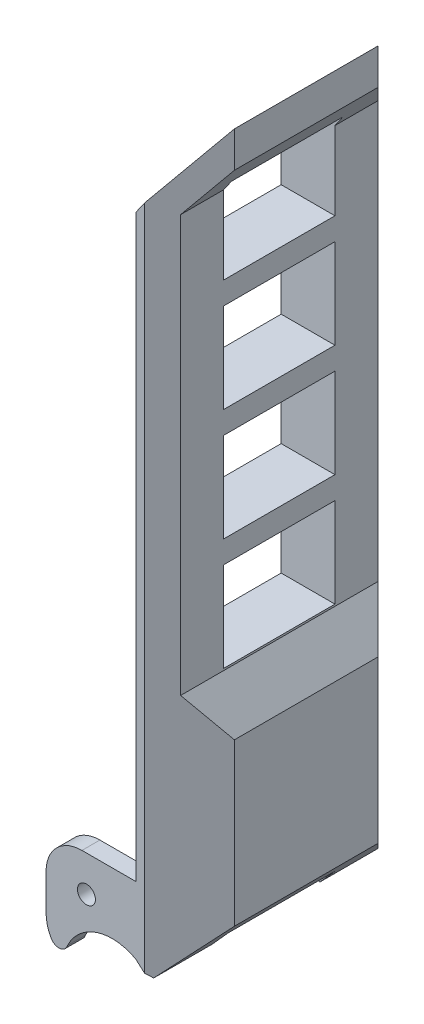
from build123d import *

# Parameters (mm, degrees)
SKETCH_1_W             = 26
SKETCH_1_H             = 82
EXTRUDE_1_DEPTH        = 9
CHAMFER_1_SIZE         = 5
CUT_EXTRUDE_1_DEPTH    = 87.492774265
SKETCH_3_OUTSIDE_W     = 45.298
SKETCH_3_OUTSIDE_H     = 101.298
SKETCH_3_OUTSIDE_W_2   = 20
SKETCH_3_OUTSIDE_H_2   = 55
CUT_EXTRUDE_2_DEPTH    = 3
SKETCH_4_W             = 12.420254628
SKETCH_4_H             = 10
CUT_EXTRUDE_3_DEPTH    = 87.492774265
PATTERN_LINEAR_1_COUNT = 4
PATTERN_LINEAR_1_PITCH = 12.5
CUT_EXTRUDE_4_DEPTH    = 87.492774265
SKETCH_6_W             = 12
SKETCH_6_H             = 2
CUT_EXTRUDE_5_DEPTH    = 87.492774265
SKETCH_7_W             = 15
SKETCH_7_H             = 18
CUT_EXTRUDE_6_DEPTH    = 4
CUT_EXTRUDE_7_DEPTH    = 87.492774265
CHAMFER_2_SIZE         = 1
CHAMFER_2_SIZE2        = 2
CHAMFER_3_SIZE2        = 1
CHAMFER_3_SIZE         = 4
CHAMFER_4_SIZE2        = 4
CHAMFER_4_SIZE         = 1
CHAMFER_5_SIZE         = 4.17
CHAMFER_5_SIZE_2       = 4
RIB_1_DEPTH            = 1.5
SKETCH_10_R            = 3.5
CUT_EXTRUDE_8_DEPTH    = 1.5
EXTRUDE_2_DEPTH        = 2
FILLET_1_R             = 4
FILLET_2_R             = 4.5
SKETCH_12_R            = 1
CUT_EXTRUDE_9_DEPTH    = 2
FILLET_1_OF_MIRROR_2_R = 4
FILLET_2_OF_MIRROR_2_R = 4.5
FILLET_3_R             = 1
SKETCH_13_R            = 1.5
CUT_EXTRUDE_11_DEPTH   = 2


# Read off the part's stored shape, not the designer's step: 筋1
# Some blends are built 0.0001 mm under size
with BuildPart() as part:
    # 草图1 → 凸台-拉伸1 (new body)
    with BuildSketch(Plane(origin=(0, 0, 0), x_dir=(0, 0, -1), z_dir=(1, 0, 0))):
        with Locations((13, -41)):
            Rectangle(SKETCH_1_W, SKETCH_1_H)
    extrude(amount=EXTRUDE_1_DEPTH)

    # 倒角1
    chamfer_1_edges = [part.edges().sort_by_distance(p)[0] for p in [
        (9, -41, -26),
        (9, -41, 0),
    ]]
    chamfer(chamfer_1_edges, length=CHAMFER_1_SIZE)

    # 草图2 → 切除-拉伸1 (cut, through all)
    with BuildSketch(Plane.XY):
        Polygon((9, 0), (0, -12.853332061), (0, 0), align=None)
        Polygon((9, -4), (6, -8.28444402), (6, -54.71555598), (9, -59), align=None)
    extrude(amount=-CUT_EXTRUDE_1_DEPTH, mode=Mode.SUBTRACT)

    # 草图3 outside → 切除-拉伸2 (cut)
    with BuildSketch(Plane.ZY):
        with Locations((-13, -41)):
            Rectangle(SKETCH_3_OUTSIDE_W, SKETCH_3_OUTSIDE_H)
        with Locations((-13, -31)):
            Rectangle(SKETCH_3_OUTSIDE_W_2, SKETCH_3_OUTSIDE_H_2, mode=Mode.SUBTRACT)
    extrude(amount=-CUT_EXTRUDE_2_DEPTH, mode=Mode.SUBTRACT)

    # 草图4 → 切除-拉伸3 (cut, through all)
    with BuildSketch(Plane.ZY):
        with Locations((-13, -12)):
            Rectangle(SKETCH_4_W, SKETCH_4_H)
    cut_extrude_3 = extrude(amount=-CUT_EXTRUDE_3_DEPTH, mode=Mode.SUBTRACT)

    # 阵列(线性)1: 切除-拉伸3 ×4
    with Locations(*[(0, -i * PATTERN_LINEAR_1_PITCH, 0) for i in range(1, PATTERN_LINEAR_1_COUNT)]):
        add(cut_extrude_3, mode=Mode.SUBTRACT)

    # 草图5 → 切除-拉伸4 (cut, through all)
    with BuildSketch(Plane.XY):
        Polygon((9, -77), (9, -82), (4.5, -82), align=None)
    extrude(amount=-CUT_EXTRUDE_4_DEPTH, mode=Mode.SUBTRACT)

    # 草图6 → 切除-拉伸5 (cut, through all)
    with BuildSketch(Plane(origin=(9, 0, 0), x_dir=(0, 0, -1), z_dir=(1, 0, 0))):
        with Locations((13, -81)):
            Rectangle(SKETCH_6_W, SKETCH_6_H)
    extrude(amount=-CUT_EXTRUDE_5_DEPTH, mode=Mode.SUBTRACT)

    # 草图7 → 切除-拉伸6 (cut)
    with BuildSketch(Plane.ZY.offset(-3)):
        with Locations((-13, -67.5)):
            Rectangle(SKETCH_7_W, SKETCH_7_H)
    extrude(amount=-CUT_EXTRUDE_6_DEPTH, mode=Mode.SUBTRACT)

    # 草图8 → 切除-拉伸7 (cut, through all)
    with BuildSketch(Plane.XY):
        Polygon((4.5, -82), (3, -80.677124344), (3, -82), align=None)
    extrude(amount=-CUT_EXTRUDE_7_DEPTH, mode=Mode.SUBTRACT)

    # 倒角2
    chamfer_2_edges = [part.edges().sort_by_distance(p)[0] for p in [
        (7, -58.5, -13),
    ]]
    chamfer_2_side = [part.faces().sort_by_distance(p)[0] for p in [
        (3.25, -58.5, -13),
    ]]
    chamfer(chamfer_2_edges, length=CHAMFER_2_SIZE, length2=CHAMFER_2_SIZE2, reference=chamfer_2_side[0])

    # 倒角3
    chamfer_3_edges = [part.edges().sort_by_distance(p)[0] for p in [
        (3, -67.5, -5.5),
    ]]
    chamfer_3_side = [part.faces().sort_by_distance(p)[0] for p in [
        (3.02, -67.5, -5.5),
    ]]
    chamfer(chamfer_3_edges, length=CHAMFER_3_SIZE - 0.0001, length2=CHAMFER_3_SIZE2 - 0.0001, reference=chamfer_3_side[0])  # a hair under: the kernel refuses the full size

    # 倒角4
    chamfer_4_edges = [part.edges().sort_by_distance(p)[0] for p in [
        (3, -67.5, -20.5),
    ]]
    chamfer_4_side = [part.faces().sort_by_distance(p)[0] for p in [
        (3, -67.5, -20.52),
    ]]
    chamfer(chamfer_4_edges, length=CHAMFER_4_SIZE - 0.0001, length2=CHAMFER_4_SIZE2 - 0.0001, reference=chamfer_4_side[0])  # a hair under: the kernel refuses the full size

    # 倒角5
    # the kernel refuses this chamfer: 4.17, 4 mm, written as the material it takes off along each edge
    with BuildSketch(Plane(origin=(3, -76.5, 6.229717564), x_dir=(-0.026903120245147794, -0.9996380455550276, 0), z_dir=(0, 0, -1))) as chamfer_5_piece_1_section:
        Polygon((CHAMFER_5_SIZE * 0.999638045555, -CHAMFER_5_SIZE * 0.0269031202451), (-CHAMFER_5_SIZE_2 * 0.0269031202451, -CHAMFER_5_SIZE_2 * 0.999638045555), (0, 0), align=None)
    chamfer_5_piece_1 = extrude(amount=38.459435128, mode=Mode.PRIVATE)
    chamfer_5_piece_1 = split(chamfer_5_piece_1, bisect_by=Plane(origin=(3.319672902, -80.226492904, -4.580012231), z_dir=(-0.24251850433325217, 0, -0.9701467801605912)), keep=Keep.TOP, mode=Mode.PRIVATE)
    chamfer_5_piece_1 = split(chamfer_5_piece_1, bisect_by=Plane(origin=(7.071862718, -80.226492904, -20.48201067), z_dir=(-0.24251850433325217, 0, 0.9701467801605912)), keep=Keep.TOP, mode=Mode.PRIVATE)
    add(chamfer_5_piece_1, mode=Mode.SUBTRACT)

    # 筋1 outline → 筋1 (add)
    with BuildSketch(Plane.XY.offset(-10.5)):
        Polygon((0, -74), (0, -80), (3.642685851, -80), (7, -76.5), (7, -73.5), align=None)
    rib_1 = extrude(amount=RIB_1_DEPTH)

    # 草图10 → 切除-拉伸8 (cut)
    with BuildSketch(Plane(origin=(0, 0, -10.5), x_dir=(-1, 0, 0), z_dir=(0, 0, -1))):
        with Locations((3, -77)):
            Circle(SKETCH_10_R)
    cut_extrude_8 = extrude(amount=-CUT_EXTRUDE_8_DEPTH, mode=Mode.SUBTRACT)

    # 镜向1: 筋1, 切除-拉伸8 across plane
    add(rib_1.mirror(Plane.XY.offset(-13)))
    add(cut_extrude_8.mirror(Plane.XY.offset(-13)), mode=Mode.SUBTRACT)

    # 草图11 → 凸台-拉伸2 (add)
    with BuildSketch(Plane(origin=(0, 0, -26), x_dir=(-1, 0, 0), z_dir=(0, 0, -1))):
        with BuildLine():
            Line((-3, -80.677124344), (-3, -73.177124344))
            Line((-3, -73.177124344), (7, -73.177124344))
            Line((7, -73.177124344), (7, -85.177124344))
            Line((7, -85.177124344), (4.616572218, -85.177124344))
            Line((4.616572218, -85.177124344), (4.616572218, -83.177124344))
            ThreePointArc((4.616572218, -83.177124344), (1.349260187, -80.278977091), (-3, -80.677124344))
        make_face()
    extrude_2 = extrude(amount=-EXTRUDE_2_DEPTH)

    # 圆角1
    fillet_1_edges = [part.edges().sort_by_distance(p)[0] for p in [
        (-7, -73.177124344, -25),
    ]]
    fillet(fillet_1_edges, radius=FILLET_1_R)

    # 圆角2
    # the kernel refuses this fillet: 4.5 mm, written as the material it takes off along each edge
    with BuildSketch(Plane(origin=(-7, -85.177124344, -35.927903243), x_dir=(0, 1, 0), z_dir=(0, 0, 1))) as fillet_2_piece_1:
        with BuildLine():
            CenterArc((3.971161297, -4.5), FILLET_2_R, 90, 61.943021953)
            Line((0, -2.383427782), (-0.079423226, -2.341096338))
            ThreePointArc((-0.079423226, -2.341096338), (-0.09, -1.191713891), (-0.09, 0))
            Line((-0.09, 0), (0, 0.09))
            Line((0, 0.09), (3.971161297, 0.09))
            Line((3.971161297, 0.09), (3.971161297, 0))
        make_face()
    extrude(amount=21.855806485, mode=Mode.SUBTRACT)

    # 草图12 → 切除-拉伸9 (cut)
    with BuildSketch(Plane(origin=(0, 0, -26), x_dir=(-1, 0, 0), z_dir=(0, 0, -1))):
        with Locations(Location((2.5, -77.177124344, 0), (0, 0, 90))):
            Circle(SKETCH_12_R)
    cut_extrude_9 = extrude(amount=-CUT_EXTRUDE_9_DEPTH, mode=Mode.SUBTRACT)

    # 镜向2: 凸台-拉伸2, 切除-拉伸9 across plane
    add(extrude_2.mirror(Plane.XY.offset(-13)))
    add(cut_extrude_9.mirror(Plane.XY.offset(-13)), mode=Mode.SUBTRACT)

    # 圆角1 of 镜向2
    fillet_1_of_mirror_2_edges = [part.edges().sort_by_distance(p)[0] for p in [
        (-7, -73.177124344, -1),
    ]]
    fillet(fillet_1_of_mirror_2_edges, radius=FILLET_1_OF_MIRROR_2_R)

    # 圆角2 of 镜向2
    # the kernel refuses this fillet: 4.5 mm, written as the material it takes off along each edge
    with BuildSketch(Plane(origin=(-7, -85.177124344, 9.927903243), x_dir=(0, 1, 0), z_dir=(0, 0, -1))) as fillet_2_of_mirror_2_piece_1:
        with BuildLine():
            CenterArc((3.971161297, 4.5), FILLET_2_OF_MIRROR_2_R, 208.056978047, 61.943021953)
            Line((0, 2.383427782), (-0.079423226, 2.341096338))
            ThreePointArc((-0.079423226, 2.341096338), (-0.09, 1.191713891), (-0.09, 0))
            Line((-0.09, 0), (0, -0.09))
            Line((0, -0.09), (3.971161297, -0.09))
            Line((3.971161297, -0.09), (3.971161297, 0))
        make_face()
    extrude(amount=21.855806485, mode=Mode.SUBTRACT)

    # 圆角3
    # the kernel refuses this fillet: 1 mm, written as the material it takes off along each edge
    with BuildSketch(Plane(origin=(-4.616572218, -85.177124344, -32.450380338), x_dir=(-0.7105970280063522, 0.7035992209976782, 0), z_dir=(0, 0, 1))) as fillet_3_piece_1:
        with BuildLine():
            CenterArc((2.293468564, -0.958025329), FILLET_3_R, 73.340489996, 134.251279475)
            Line((1.407198442, -1.421194056), (1.38947304, -1.430457431))
            ThreePointArc((1.38947304, -1.430457431), (0.68938728, -0.724669012), (-0.014211941, -0.014071984))
            Line((-0.014211941, -0.014071984), (-0.005733671, 0.019160507))
            ThreePointArc((-0.005733671, 0.019160507), (1.290076068, 0.208886021), (2.585885806, 0.019160507))
            Line((2.585885806, 0.019160507), (2.580152135, 0))
        make_face()
    extrude(amount=14.900760675, mode=Mode.SUBTRACT)
    with BuildSketch(Plane(origin=(-4.616572218, -85.177124344, 6.450380338), x_dir=(0, 1, 0), z_dir=(0, 0, -1))) as fillet_3_piece_2:
        with BuildLine():
            CenterArc((2.294452647, -0.955666071), FILLET_3_R, 107.12471858, 134.251279475)
            Line((1.815393032, -1.833448439), (1.80581184, -1.851004086))
            ThreePointArc((1.80581184, -1.851004086), (0.75926273, -1.063696261), (-0.017649606, -0.009406988))
            Line((-0.017649606, -0.009406988), (0, 0.02))
            ThreePointArc((0, 0.02), (1, 0.02), (1.994110947, 0.019113321))
            Line((1.994110947, 0.019113321), (2, 0))
        make_face()
    extrude(amount=14.900760675, mode=Mode.SUBTRACT)

    # 草图13 → 切除-拉伸11 (cut)
    with BuildSketch(Plane(origin=(0, 0, -26), x_dir=(-1, 0, 0), z_dir=(0, 0, -1))):
        with Locations(Location((2.5, -77.177124344, 0), (0, 0, 90))):
            Circle(SKETCH_13_R)
    extrude(amount=-CUT_EXTRUDE_11_DEPTH, mode=Mode.SUBTRACT)


solid = part.part
